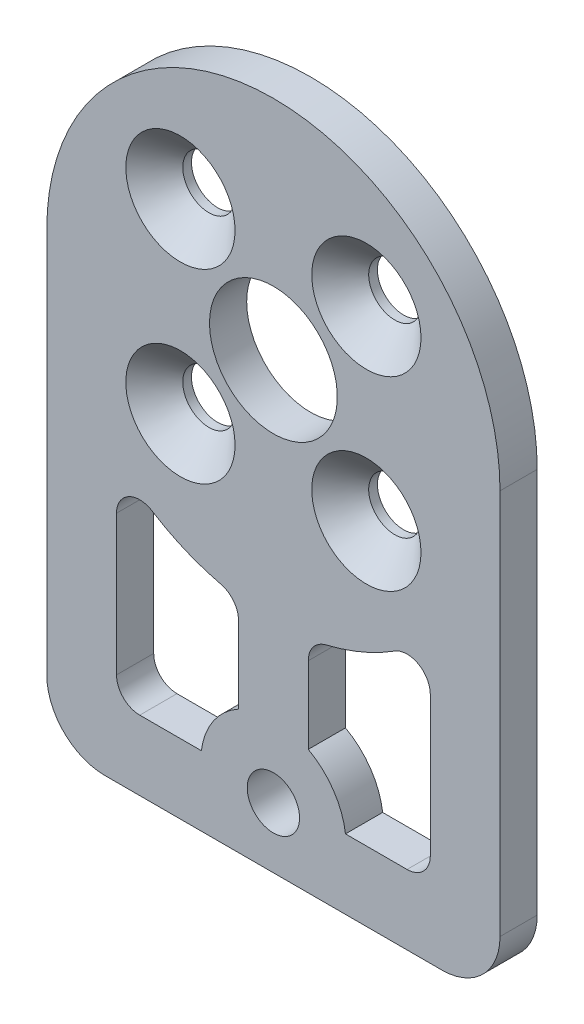
from build123d import *

# Parameters (mm, degrees)
STOCK_SPINE_MASTER_1_START                   = -34.2
STOCK_SPINE_MASTER_1_OUTLINE_R               = 2.25
STOCK_SPINE_MASTER_1_OUTLINE_R_2             = 5.5
STOCK_SPINE_MASTER_1_DEPTH                   = 3.2
FILLET1_R                                    = 5
CUT_EXTRUDE2_DEPTH                           = 44.022458369
FILLET2_R                                    = 2
CSK_FOR_M4_COUNTERSUNK_FLAT_HEAD_SCR_2_COUNT = 2
CSK_FOR_M4_COUNTERSUNK_FLAT_HEAD_SCR_2_PITCH = 16
CSK_FOR_M4_COUNTERSUNK_FLAT_HEAD_SCR_3_COUNT = 2
CSK_FOR_M4_COUNTERSUNK_FLAT_HEAD_SCR_3_PITCH = 22.627416998
CSK_FOR_M4_COUNTERSUNK_FLAT_HEAD_SCR_4_COUNT = 2
CSK_FOR_M4_COUNTERSUNK_FLAT_HEAD_SCR_4_PITCH = 16


# Read off the part's stored shape, not the designer's step: Stock-spine_master-1
with BuildPart() as part:
    # Stock-spine_master-1 outline → Stock-spine_master-1 (new body)
    with BuildSketch(Plane.XY.offset(STOCK_SPINE_MASTER_1_START)):
        with BuildLine():
            Line((19.5, -38.215728753), (19.5, 0))
            ThreePointArc((19.5, 0), (0, 19.5), (-19.5, 0))
            Line((-19.5, 0), (-19.5, -38.215728753))
            Line((-19.5, -38.215728753), (19.5, -38.215728753))
        make_face()
        with Locations((0, -33)):
            Circle(STOCK_SPINE_MASTER_1_OUTLINE_R, mode=Mode.SUBTRACT)
        with Locations((-8, -8)):
            Circle(STOCK_SPINE_MASTER_1_OUTLINE_R, mode=Mode.SUBTRACT)
        with Locations((-8, 8)):
            Circle(STOCK_SPINE_MASTER_1_OUTLINE_R, mode=Mode.SUBTRACT)
        with Locations((8, -8)):
            Circle(STOCK_SPINE_MASTER_1_OUTLINE_R, mode=Mode.SUBTRACT)
        Circle(STOCK_SPINE_MASTER_1_OUTLINE_R_2, mode=Mode.SUBTRACT)
        with Locations((8, 8)):
            Circle(STOCK_SPINE_MASTER_1_OUTLINE_R, mode=Mode.SUBTRACT)
    extrude(amount=STOCK_SPINE_MASTER_1_DEPTH)

    # Fillet1
    fillet1_edges = [part.edges().sort_by_distance(p)[0] for p in [
        (-19.5, -38.215728753, -32.6),
        (19.5, -38.215728753, -32.6),
    ]]
    fillet(fillet1_edges, radius=FILLET1_R)

    # Sketch1 → Cut-Extrude2 (cut, through all)
    with BuildSketch(Plane.XY.offset(-31)):
        with BuildLine():
            ThreePointArc((13.5, -14.071247279), (8.649489408, -17.476736909), (3, -19.267848868))
            Line((3, -19.267848868), (3, -27.51707195))
            ThreePointArc((3, -27.51707195), (5.165471514, -29.481420167), (6.200598246, -32.215728753))
            Line((6.200598246, -32.215728753), (6.25, -32.215728753))
            Line((6.25, -32.215728753), (13.5, -32.215728753))
            Line((13.5, -32.215728753), (13.5, -14.071247279))
        make_face()
        with BuildLine():
            Line((-3, -27.51707195), (-3, -19.267848868))
            ThreePointArc((-3, -19.267848868), (-8.649489408, -17.476736909), (-13.5, -14.071247279))
            Line((-13.5, -14.071247279), (-13.5, -32.215728753))
            Line((-13.5, -32.215728753), (-6.25, -32.215728753))
            Line((-6.25, -32.215728753), (-6.200598246, -32.215728753))
            ThreePointArc((-6.200598246, -32.215728753), (-5.165471514, -29.481420167), (-3, -27.51707195))
        make_face()
    extrude(amount=-CUT_EXTRUDE2_DEPTH, mode=Mode.SUBTRACT)

    # Fillet2
    fillet2_edges = [part.edges().sort_by_distance(p)[0] for p in [
        (3, -19.267848868, -32.6),
        (13.5, -14.071247279, -32.6),
        (13.5, -32.215728753, -32.6),
        (-13.5, -14.071247279, -32.6),
        (-3, -19.267848868, -32.6),
        (-13.5, -32.215728753, -32.6),
    ]]
    fillet(fillet2_edges, radius=FILLET2_R)

    # Sketch4 → CSK for M4 Countersunk Flat Head Screw1 (revolve, cut)
    with BuildSketch(Plane(origin=(-8, -8, -31), x_dir=(0, -1, 0), z_dir=(1, 0, 0))):
        Polygon((0, 0), (0, 3.2), (2.25, 3.2), (2.25, 2.45), (4.7, 0), align=None)
    csk_for_m4_countersunk_flat_head_screw1 = revolve(axis=Axis((-8, -8, -24.65), (0, 0, -1)), mode=Mode.SUBTRACT)

    # CSK for M4 Countersunk Flat Head Scr 2: CSK for M4 Countersunk Flat Head Screw1 ×2
    with Locations(*[(i * CSK_FOR_M4_COUNTERSUNK_FLAT_HEAD_SCR_2_PITCH, 0, 0) for i in range(1, CSK_FOR_M4_COUNTERSUNK_FLAT_HEAD_SCR_2_COUNT)]):
        add(csk_for_m4_countersunk_flat_head_screw1, mode=Mode.SUBTRACT)

    # CSK for M4 Countersunk Flat Head Scr 3: CSK for M4 Countersunk Flat Head Screw1 ×2
    with Locations(*[Vector(0.7071067811865426, 0.7071067811865526, 0) * (i * CSK_FOR_M4_COUNTERSUNK_FLAT_HEAD_SCR_3_PITCH) for i in range(1, CSK_FOR_M4_COUNTERSUNK_FLAT_HEAD_SCR_3_COUNT)]):
        add(csk_for_m4_countersunk_flat_head_screw1, mode=Mode.SUBTRACT)

    # CSK for M4 Countersunk Flat Head Scr 4: CSK for M4 Countersunk Flat Head Screw1 ×2
    with Locations(*[(0, i * CSK_FOR_M4_COUNTERSUNK_FLAT_HEAD_SCR_4_PITCH, 0) for i in range(1, CSK_FOR_M4_COUNTERSUNK_FLAT_HEAD_SCR_4_COUNT)]):
        add(csk_for_m4_countersunk_flat_head_screw1, mode=Mode.SUBTRACT)


solid = part.part
